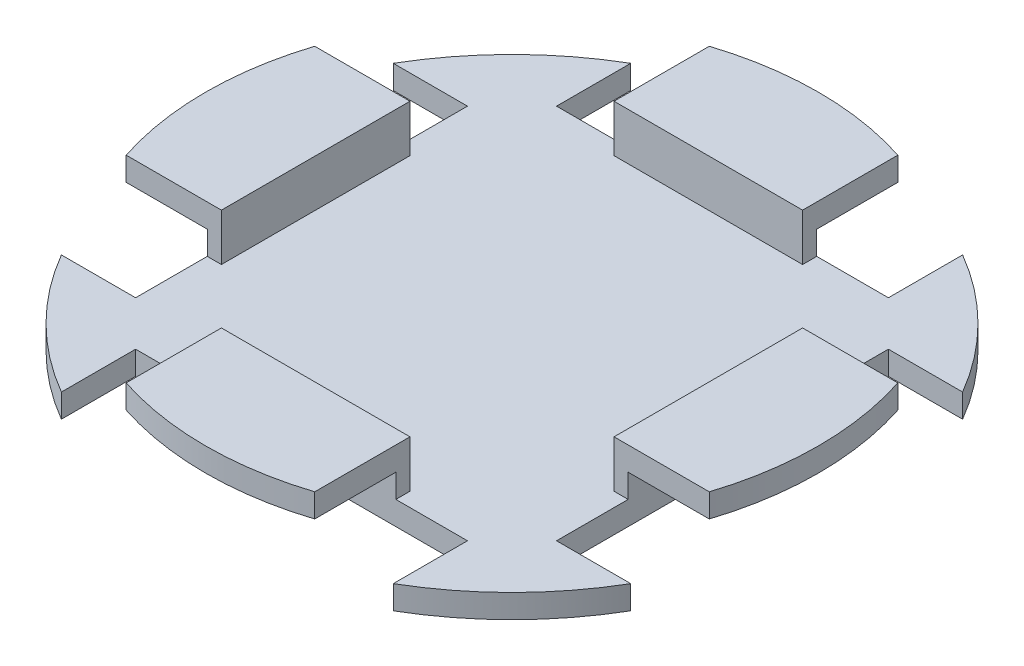
from build123d import *

# Parameters (mm, degrees)
SKETCH1_R         = 88.773
BASE_DEPTH        = 6.35
STOPPER_DEPTH     = 12.7
STOPPER_START     = -6.35
STOPPER_GAP_DEPTH = 121.63107559
CIRPATTERN1_COUNT = 4


with BuildPart() as part:
    # Sketch1 → Base (new body)
    with BuildSketch(Plane(origin=(0, 0, 0), x_dir=(1, 0, 0), z_dir=(0, 1, 0))):
        Circle(SKETCH1_R)
    extrude(amount=BASE_DEPTH)

    # Sketch2 → Stopper (add)
    with BuildSketch(Plane(origin=(0, 6.35, 0), x_dir=(1, 0, 0), z_dir=(0, 1, 0))):
        with BuildLine():
            Line((-25.4, -78.545162168), (-25.4, -52.891162168))
            Line((-25.4, -52.891162168), (0, -52.891162168))
            Line((0, -52.891162168), (25.4, -52.891162168))
            Line((25.4, -52.891162168), (25.4, -78.545162168))
            ThreePointArc((25.4, -78.545162168), (12.856892374, -81.542644172), (0, -82.55))
            ThreePointArc((0, -82.55), (-12.856892374, -81.542644172), (-25.4, -78.545162168))
        make_face()
    stopper = extrude(amount=STOPPER_DEPTH)

    # Sketch5 → Stopper Gap (cut, through all)
    with BuildSketch(Plane(origin=(0, 19.05, 0), x_dir=(1, 0, 0), z_dir=(0, 1, 0)).offset(STOPPER_START)):
        with BuildLine():
            Line((-44.704, -76.695488218), (-44.704, -56.701162168))
            Line((-44.704, -56.701162168), (0, -56.701162168))
            Line((0, -56.701162168), (44.704, -56.701162168))
            Line((44.704, -56.701162168), (44.704, -76.695488218))
            ThreePointArc((44.704, -76.695488218), (23.153368582, -85.700449545), (0, -88.773))
            ThreePointArc((0, -88.773), (-23.153368582, -85.700449545), (-44.704, -76.695488218))
        make_face()
    stopper_gap = extrude(amount=-STOPPER_GAP_DEPTH, mode=Mode.SUBTRACT)

    # CirPattern1: Stopper, Stopper Gap ×4 about axis
    cirpattern1_axis = Axis((0, 6.35, 0), (0, 1, 0))
    add([stopper.rotate(cirpattern1_axis, i * 360 / CIRPATTERN1_COUNT) for i in range(1, CIRPATTERN1_COUNT)])
    add([stopper_gap.rotate(cirpattern1_axis, i * 360 / CIRPATTERN1_COUNT) for i in range(1, CIRPATTERN1_COUNT)], mode=Mode.SUBTRACT)


solid = part.part
